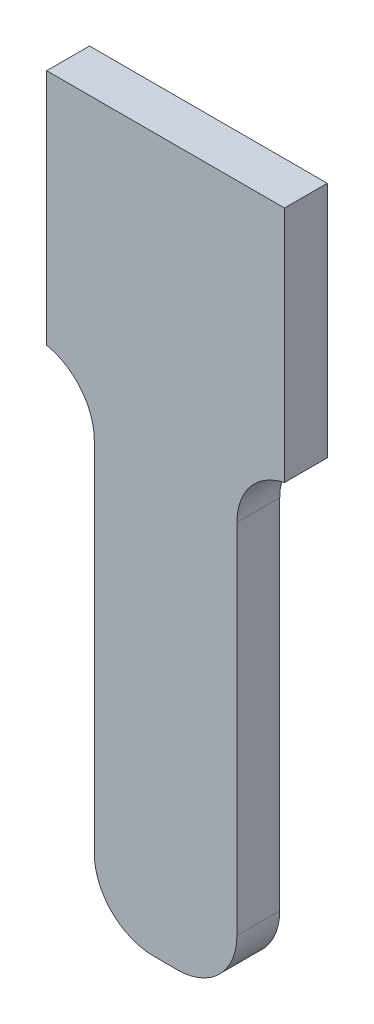
from build123d import *

# Parameters (mm, degrees)
SKETCH1_W           = 7.62
SKETCH1_H           = 25.4
SKETCH1_W_2         = 12.7
SKETCH1_H_2         = 12.7
BOSS_EXTRUDE1_DEPTH = 2.286
FILLET1_R           = 3.175


with BuildPart() as part:
    # Sketch1 → Boss-Extrude1 (new body)
    with BuildSketch(Plane.XY):
        with Locations((0, -19.05)):
            Rectangle(SKETCH1_W, SKETCH1_H)
        Rectangle(SKETCH1_W_2, SKETCH1_H_2)
    extrude(amount=BOSS_EXTRUDE1_DEPTH)

    # Fillet1
    # the kernel refuses this fillet: 3.175 mm, written as the material it adds along each edge
    with BuildSketch(Plane(origin=(-3.81, -6.35, 0), x_dir=(-1.0, -1.5648025307703881e-12, 0), z_dir=(0, 0, 1))) as fillet1_piece_1:
        with BuildLine():
            CenterArc((3.175, 3.110851973), FILLET1_R, 180, 78.463040967)
            Line((0, 3.110851973), (0, 0))
            Line((0, 0), (2.54, 0))
        make_face()
    extrude(amount=2.286)
    with BuildSketch(Plane(origin=(3.81, -6.35, 0), x_dir=(1.0, -1.5644528542271996e-12, 0), z_dir=(0, 0, 1))) as fillet1_piece_2:
        with BuildLine():
            CenterArc((3.175, -3.110851973), FILLET1_R, 101.536959033, 78.463040967)
            Line((0, -3.110851973), (0, 0))
            Line((0, 0), (2.54, 0))
        make_face()
    extrude(amount=2.286)
    # the kernel refuses this fillet: 3.175 mm, written as the material it takes off along each edge
    with BuildSketch(Plane(origin=(-3.81, -31.75, -7.9375), x_dir=(1, 0, 0), z_dir=(0, 0, 1)), Plane(origin=(3.81, -31.75, -7.9375), x_dir=(0, 1, 0), z_dir=(0, 0, 1))) as fillet1_2_piece_1:
        with BuildLine():
            CenterArc((FILLET1_R, FILLET1_R), FILLET1_R, 180, 90)
            Line((0, FILLET1_R), (0, 0))
            Line((0, 0), (FILLET1_R, 0))
        make_face()
    extrude(amount=18.161, mode=Mode.SUBTRACT)


solid = part.part
